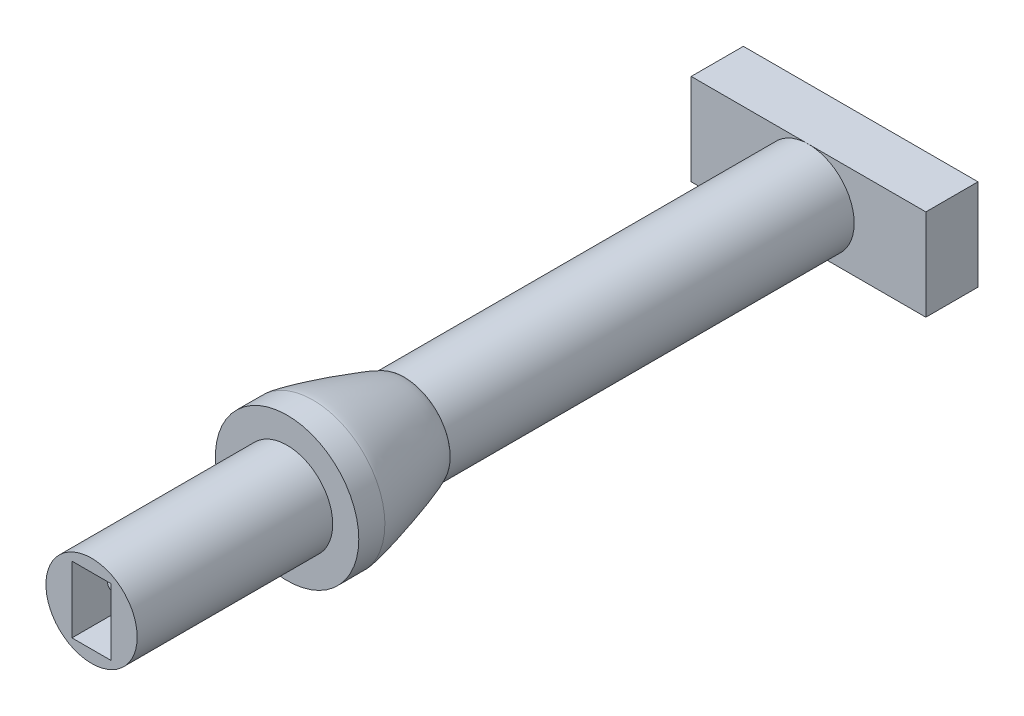
from build123d import *

# Parameters (mm, degrees)
SCHIZZO2_W                    = 18
SCHIZZO2_H                    = 7
ESTRUSIONE_ESTRUSIONE1_DEPTH  = 4
SCHIZZO3_R                    = 3.5
ESTRUSIONE_ESTRUSIONE2_DEPTH  = 55
SCHIZZO4_W                    = 3
SCHIZZO4_H                    = 5.1
TAGLIO_ESTRUSIONE1_DEPTH      = 8.2
TAGLIO_ESTRUSIONE2_REACH      = 62.029
TAGLIO_ESTRUSIONE2_END_RADIUS = 3.5
SCHIZZO5_R                    = 1.5
SCHIZZO6_R                    = 5.5
ESTRUSIONE_ESTRUSIONE3_DEPTH  = 9
RACCORDO1_SIZE                = 2
RACCORDO1_SIZE_2              = 7
SCHIZZO7_R                    = 1
TAGLIO_ESTRUSIONE3_DEPTH      = 2


with BuildPart() as part:
    # Schizzo2 → Estrusione-Estrusione1 (new body)
    with BuildSketch(Plane.XY):
        Rectangle(SCHIZZO2_W, SCHIZZO2_H)
    extrude(amount=ESTRUSIONE_ESTRUSIONE1_DEPTH)

    # Schizzo3 → Estrusione-Estrusione2 (add)
    with BuildSketch(Plane.XY.offset(4)):
        with Locations(Location((0, 0, 0), (0, 0, 270))):
            Circle(SCHIZZO3_R)
    extrude(amount=ESTRUSIONE_ESTRUSIONE2_DEPTH)

    # Schizzo4 → Taglio-Estrusione1 (cut)
    with BuildSketch(Plane.XY.offset(59)):
        Rectangle(SCHIZZO4_W, SCHIZZO4_H)
    extrude(amount=-TAGLIO_ESTRUSIONE1_DEPTH, mode=Mode.SUBTRACT)

    # Taglio-Estrusione2: up to this cylinder (the profile starts inside it)
    taglio_estrusione2_end = Plane(origin=(0, 0, 54.8), z_dir=(0, 0, -1)) * Cylinder(TAGLIO_ESTRUSIONE2_END_RADIUS, 132.058, mode=Mode.PRIVATE)
    # Schizzo5 → Taglio-Estrusione2 (cut, up to the surface)
    with BuildSketch(Plane(origin=(-1.5, 0, 0), x_dir=(0, 0, -1), z_dir=(1, 0, 0)), mode=Mode.PRIVATE) as taglio_estrusione2_sk1:
        with Locations(Location((-54.8, 0, 0), (0, 0, 90))):
            Circle(SCHIZZO5_R)
    taglio_estrusione2_tool1 = extrude(taglio_estrusione2_sk1.sketch, amount=-TAGLIO_ESTRUSIONE2_REACH, mode=Mode.PRIVATE) & taglio_estrusione2_end
    add(taglio_estrusione2_tool1.solids().sort_by_distance((-1.5, 0, 54.8))[0], mode=Mode.SUBTRACT)

    # Schizzo6 → Estrusione-Estrusione3 (add)
    with BuildSketch(Plane.XY.offset(44)):
        Circle(SCHIZZO6_R)
    extrude(amount=-ESTRUSIONE_ESTRUSIONE3_DEPTH)

    # Raccordo1
    # a fillet whose section is not a circle: 7, 2 mm, written as the material it takes off along each edge
    with BuildSketch(Plane(origin=(0, 0, 35), x_dir=(1, 0, 0), z_dir=(0, -1, 0))) as raccordo1_piece_1_section:
        with BuildLine():
            Bezier((5.5 - RACCORDO1_SIZE, 0), (5.5, 0), (5.5, RACCORDO1_SIZE_2), weights=[1, 0.111111111, 1])
            Line((5.5, RACCORDO1_SIZE_2), (5.5, 0))
            Line((5.5, 0), (5.5 - RACCORDO1_SIZE, 0))
        make_face()
    raccordo1_piece_1 = revolve(axis=Axis((0, 0, 35), (0, 0, 1)), mode=Mode.PRIVATE)
    raccordo1_piece_1 = raccordo1_piece_1 - Plane(origin=(0, 0, 35), x_dir=(0, -1, 0), z_dir=(0, 0, -1)) * Cylinder(3.5, 28, mode=Mode.PRIVATE)
    add(raccordo1_piece_1, mode=Mode.SUBTRACT)

    # Schizzo7 → Taglio-Estrusione3 (cut)
    with BuildSketch(Plane(origin=(0, 0, 0), x_dir=(-1, 0, 0), z_dir=(0, 0, -1))):
        Circle(SCHIZZO7_R)
    extrude(amount=-TAGLIO_ESTRUSIONE3_DEPTH, mode=Mode.SUBTRACT)


solid = part.part
